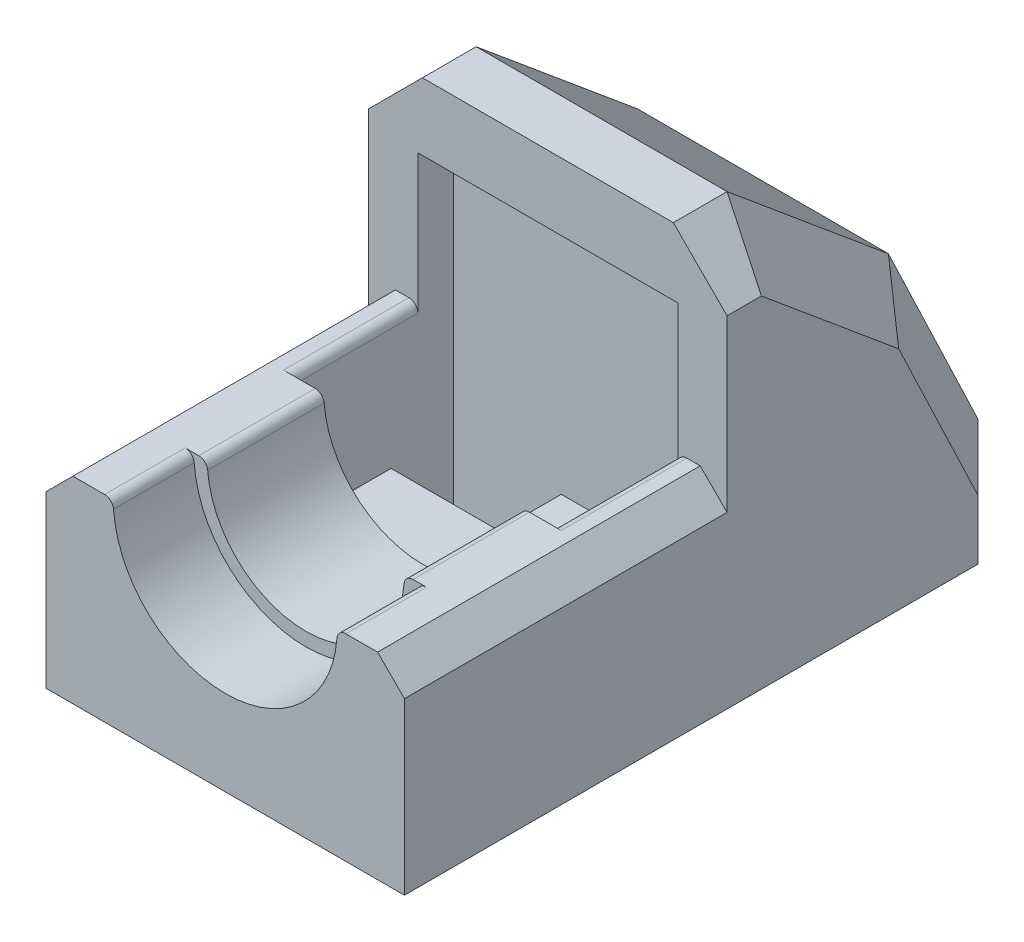
from build123d import *

# Parameters (mm, degrees)
SKIZZE1_W                       = 20
SKIZZE1_H                       = 22
AUFSATZ_LINEAR_AUSTRAGEN1_DEPTH = 35
SKIZZE2_R                       = 5.5
SCHNITT_LINEAR_AUSTRAGEN1_DEPTH = 11
SKIZZE3_R                       = 6.25
SCHNITT_LINEAR_AUSTRAGEN2_DEPTH = 4.5
SKIZZE5_W                       = 14.5
SKIZZE5_H                       = 14.5
SCHNITT_LINEAR_AUSTRAGEN3_DEPTH = 9
SKIZZE13_W                      = 20
SKIZZE13_H                      = 11
SCHNITT_LINEAR_AUSTRAGEN6_DEPTH = 18
SCHNITT_LINEAR_AUSTRAGEN7_DEPTH = 46.923850013
VERRUNDUNG1_R                   = 0.5
FASE1_SIZE                      = 3
FASE2_SIZE                      = 3
FASE3_SIZE                      = 3
FASE4_SIZE                      = 1.5
SKIZZE17_W                      = 6
SKIZZE17_H                      = 3.5
SCHNITT_LINEAR_AUSTRAGEN8_DEPTH = 45.25


with BuildPart() as part:
    # Skizze1 → Aufsatz-Linear austragen1 (new body)
    with BuildSketch(Plane.XY):
        with Locations((10, 11)):
            Rectangle(SKIZZE1_W, SKIZZE1_H)
    extrude(amount=AUFSATZ_LINEAR_AUSTRAGEN1_DEPTH)

    # Skizze2 → Schnitt-Linear austragen1 (cut)
    with BuildSketch(Plane.XY.offset(35)):
        with Locations((10, 11)):
            Circle(SKIZZE2_R)
    extrude(amount=-SCHNITT_LINEAR_AUSTRAGEN1_DEPTH, mode=Mode.SUBTRACT)

    # Skizze3 → Schnitt-Linear austragen2 (cut)
    with BuildSketch(Plane.XY.offset(35)):
        with Locations((10, 11)):
            Circle(SKIZZE3_R)
    extrude(amount=-SCHNITT_LINEAR_AUSTRAGEN2_DEPTH, mode=Mode.SUBTRACT)

    # Skizze5 → Schnitt-Linear austragen3 (cut)
    with BuildSketch(Plane.XY.offset(24)):
        with Locations((10, 11)):
            Rectangle(SKIZZE5_W, SKIZZE5_H)
    extrude(amount=-SCHNITT_LINEAR_AUSTRAGEN3_DEPTH, mode=Mode.SUBTRACT)

    # Skizze13 → Schnitt-Linear austragen6 (cut)
    with BuildSketch(Plane.XY.offset(35)):
        with Locations((10, 16.5)):
            Rectangle(SKIZZE13_W, SKIZZE13_H)
    extrude(amount=-SCHNITT_LINEAR_AUSTRAGEN6_DEPTH, mode=Mode.SUBTRACT)

    # Skizze16 → Schnitt-Linear austragen7 (cut, through all)
    with BuildSketch(Plane.ZY):
        Polygon((14, 22), (5, 14.5), (0, 4), (0, 22), align=None)
    extrude(amount=-SCHNITT_LINEAR_AUSTRAGEN7_DEPTH, mode=Mode.SUBTRACT)

    # Verrundung1
    verrundung1_edges = [part.edges().sort_by_distance(p)[0] for p in [
        (16.25, 11, 32.75),
        (3.75, 11, 32.75),
        (4.5, 11, 27.25),
        (15.5, 11, 27.25),
        (17.25, 11, 20.5),
        (2.75, 11, 20.5),
    ]]
    fillet(verrundung1_edges, radius=VERRUNDUNG1_R)

    # Fase1
    fase1_edges = [part.edges().sort_by_distance(p)[0] for p in [
        (20, 22, 15.5),
        (0, 22, 15.5),
    ]]
    chamfer(fase1_edges, length=FASE1_SIZE)

    # Fase2
    fase2_edges = [part.edges().sort_by_distance(p)[0] for p in [
        (0, 16.75, 7.7),
        (20, 16.75, 7.7),
    ]]
    chamfer(fase2_edges, length=FASE2_SIZE)

    # Fase3
    fase3_edges = [part.edges().sort_by_distance(p)[0] for p in [
        (20, 6.012857042, 0.958503353),
        (20, 2, 0),
        (0, 6.012857042, 0.958503353),
        (0, 2, 0),
    ]]
    chamfer(fase3_edges, length=FASE3_SIZE)

    # Fase4
    fase4_edges = [part.edges().sort_by_distance(p)[0] for p in [
        (20, 11, 26),
        (0, 11, 26),
    ]]
    chamfer(fase4_edges, length=FASE4_SIZE)

    # Skizze17 → Schnitt-Linear austragen8 (cut, through all)
    with BuildSketch(Plane(origin=(0, 3.75, 0), x_dir=(1, 0, 0), z_dir=(0, 1, 0))):
        with Locations((5.75, -16.75)):
            Rectangle(SKIZZE17_W, SKIZZE17_H)
    extrude(amount=-SCHNITT_LINEAR_AUSTRAGEN8_DEPTH, mode=Mode.SUBTRACT)


solid = part.part
